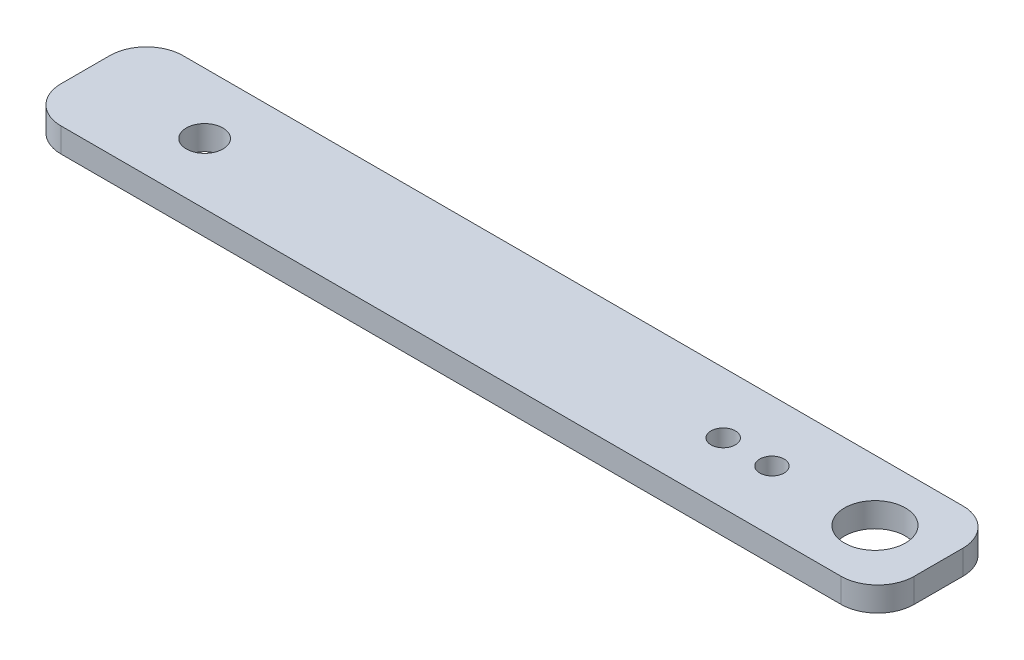
from build123d import *

# Parameters (mm, degrees)
SKETCH1_W             = 70
SKETCH1_H             = 10
BOSS_EXTRUDE1_DEPTH   = 2
F_5_0MM_DOWEL_HOLE1_D = 5
F_3_0MM_DOWEL_HOLE1_D = 3
SKETCH2_R             = 1
CUT_EXTRUDE1_DEPTH    = 3
FILLET1_R             = 3


with BuildPart() as part:
    # Sketch1 → Boss-Extrude1 (new body)
    with BuildSketch(Plane(origin=(0, 0, 0), x_dir=(1, 0, 0), z_dir=(0, 1, 0))):
        Rectangle(SKETCH1_W, SKETCH1_H)
    extrude(amount=BOSS_EXTRUDE1_DEPTH)

    # Ø5.0mm Dowel Hole1 (through all)
    with Locations(Plane(origin=(0, 2, 0), x_dir=(1, 0, 0), z_dir=(0, 1, 0))):
        with Locations((29.779724949, 0)):
            Hole(F_5_0MM_DOWEL_HOLE1_D / 2)

    # Ø3.0mm Dowel Hole1 (through all)
    with Locations(Plane(origin=(0, 2, 0), x_dir=(1, 0, 0), z_dir=(0, 1, 0))):
        with Locations((-25.220275051, 0)):
            Hole(F_3_0MM_DOWEL_HOLE1_D / 2)

    # Sketch2 → Cut-Extrude1 (cut)
    with BuildSketch(Plane(origin=(0, 2, 0), x_dir=(1, 0, 0), z_dir=(0, 1, 0))):
        with Locations((21.329724949, 0)):
            Circle(SKETCH2_R)
        with Locations((17.329724949, 0)):
            Circle(SKETCH2_R)
    extrude(amount=-CUT_EXTRUDE1_DEPTH, mode=Mode.SUBTRACT)

    # Fillet1
    fillet1_edges = [part.edges().sort_by_distance(p)[0] for p in [
        (35, 1, 5),
        (35, 1, -5),
        (-35, 1, -5),
        (-35, 1, 5),
    ]]
    fillet(fillet1_edges, radius=FILLET1_R)


solid = part.part
